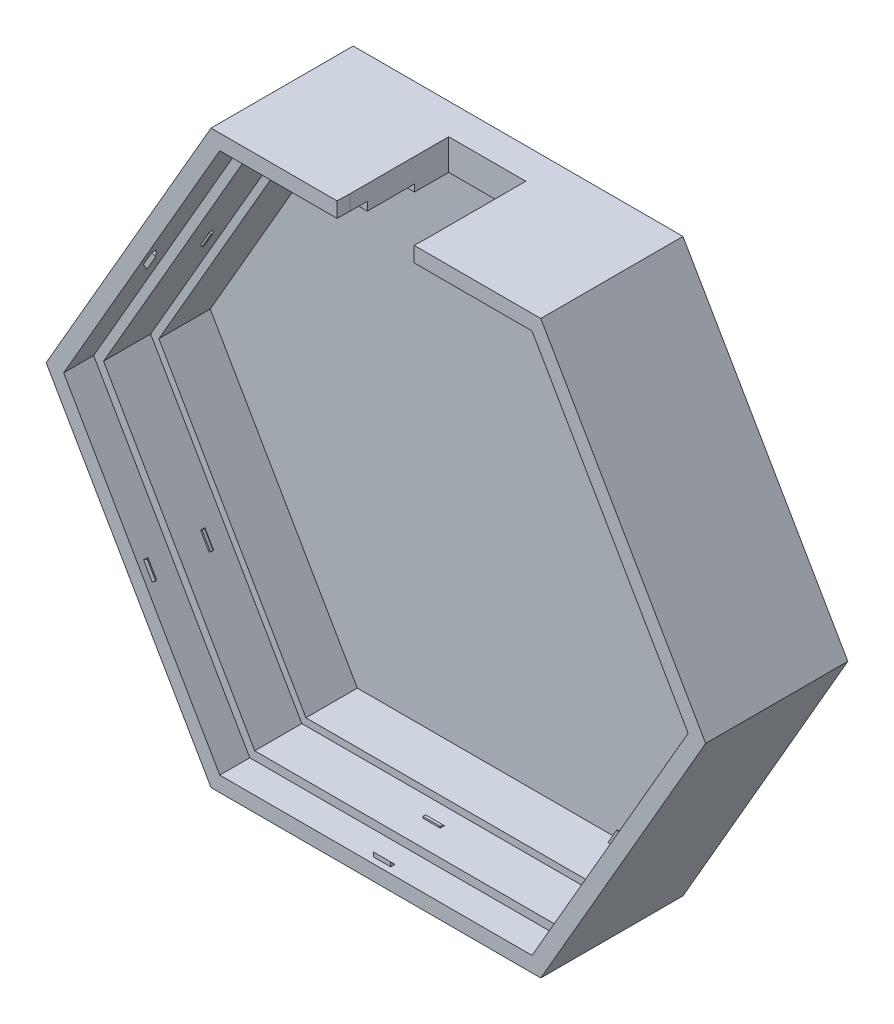
from build123d import *

# Parameters (mm, degrees)
BOSS_EXTRUDE1_DEPTH  = 10
BOSS_EXTRUDE2_DEPTH  = 1.6
BOSS_EXTRUDE5_DEPTH  = 1.6
BOSS_EXTRUDE6_DEPTH  = 2
SKETCH10_W           = 9
SKETCH10_H           = 8
CUT_EXTRUDE1_DEPTH   = 2
BOSS_EXTRUDE7_DEPTH  = 8
CUT_EXTRUDE2_DEPTH   = 4
SKETCH13_W           = 9
SKETCH13_H           = 4
CUT_EXTRUDE3_DEPTH   = 4
SKETCH16_W           = 9
SKETCH16_H           = 2
CUT_EXTRUDE4_DEPTH   = 3
BOSS_EXTRUDE10_DEPTH = 7.6
SKETCH21_W           = 9
SKETCH21_H           = 1
CUT_EXTRUDE5_DEPTH   = 6
CUT_EXTRUDE7_DEPTH   = 2.2
BOSS_EXTRUDE11_DEPTH = 2
CUT_EXTRUDE8_DEPTH   = 2
BOSS_EXTRUDE12_DEPTH = 2
BOSS_EXTRUDE13_DEPTH = 5.7
BOSS_EXTRUDE14_DEPTH = 5
CUT_EXTRUDE9_DEPTH   = 76.043267682
SKETCH30_W           = 2
SKETCH30_H           = 0.5
BOSS_EXTRUDE15_DEPTH = 0.2
CHAMFER1_SIZE        = 0.2
SKETCH31_W           = 0.5
SKETCH31_H           = 2
BOSS_EXTRUDE16_DEPTH = 0.2
CHAMFER2_SIZE        = 0.2
SKETCH32_W           = 0.5
SKETCH32_H           = 2
BOSS_EXTRUDE17_DEPTH = 0.2
CHAMFER3_SIZE        = 0.2
SKETCH33_W           = 0.5
SKETCH33_H           = 2
BOSS_EXTRUDE18_DEPTH = 0.2
CHAMFER4_SIZE        = 0.2
BOSS_EXTRUDE25_DEPTH = 2
SKETCH34_W           = 0.5
SKETCH34_H           = 2
BOSS_EXTRUDE19_DEPTH = 0.2
CHAMFER5_SIZE        = 0.2
SKETCH41_W           = 9
SKETCH41_H           = 6
CUT_EXTRUDE10_DEPTH  = 2
SKETCH42_R           = 2.75
CUT_EXTRUDE11_DEPTH  = 3.2
SKETCH50_W           = 0.5
SKETCH50_H           = 2
BOSS_EXTRUDE27_DEPTH = 0.5
SKETCH49_W           = 0.5
SKETCH49_H           = 2
BOSS_EXTRUDE28_DEPTH = 0.5
SKETCH44_W           = 2
SKETCH44_H           = 0.5
BOSS_EXTRUDE29_DEPTH = 0.5
SKETCH45_W           = 0.5
SKETCH45_H           = 2
BOSS_EXTRUDE30_DEPTH = 0.5
SKETCH47_W           = 0.5
SKETCH47_H           = 2
BOSS_EXTRUDE31_DEPTH = 0.5
CHAMFER6_SIZE        = 0.5
CHAMFER7_SIZE        = 0.5
CHAMFER8_SIZE        = 0.5
CHAMFER9_SIZE        = 0.5
CHAMFER10_SIZE       = 0.5
CUT_EXTRUDE12_DEPTH  = 30
SKETCH53_W           = 9
SKETCH53_H           = 2
BOSS_EXTRUDE32_DEPTH = 3.6


with BuildPart() as part:
    # Sketch1 → Boss-Extrude1 (new body)
    with BuildSketch(Plane.XY):
        Polygon((37.347520861, 0), (18.673760431, 32.343901834), (-18.673760431, 32.343901834), (-37.347520861, 0), (-18.673760431, -32.343901834), (18.673760431, -32.343901834), align=None)
        Polygon((35.5, 0), (17.75, 30.743901834), (-17.75, 30.743901834), (-35.5, 0), (-17.75, -30.743901834), (17.75, -30.743901834), align=None, mode=Mode.SUBTRACT)
    extrude(amount=BOSS_EXTRUDE1_DEPTH)

    # Sketch2 → Boss-Extrude2 (add)
    with BuildSketch(Plane(origin=(0, 0, 0), x_dir=(-1, 0, 0), z_dir=(0, 0, -1))):
        Polygon((36.847520861, 0), (18.423760431, 31.910889132), (-18.423760431, 31.910889132), (-36.847520861, 0), (-18.423760431, -31.910889132), (18.423760431, -31.910889132), align=None)
    extrude(amount=BOSS_EXTRUDE2_DEPTH)

    # Sketch8 → Boss-Extrude5 (add)
    with BuildSketch(Plane(origin=(0, 0, 0), x_dir=(-1, 0, 0), z_dir=(0, 0, -1))):
        Polygon((18.673760431, -32.343901834), (37.347520861, 0), (18.673760431, 32.343901834), (-18.673760431, 32.343901834), (-37.347520861, 0), (-18.673760431, -32.343901834), align=None)
    extrude(amount=BOSS_EXTRUDE5_DEPTH)

    # Sketch9 → Boss-Extrude6 (add)
    with BuildSketch(Plane.XY):
        Polygon((-17.75, 30.743901834), (-35.5, 0), (-17.75, -30.743901834), (17.75, -30.743901834), (35.5, 0), (17.75, 30.743901834), align=None)
        Polygon((-34.345299462, 0), (-17.172649731, -29.743901834), (17.172649731, -29.743901834), (34.345299462, 0), (17.172649731, 29.743901834), (-17.172649731, 29.743901834), align=None, mode=Mode.SUBTRACT)
    extrude(amount=BOSS_EXTRUDE6_DEPTH)

    # Sketch10 → Cut-Extrude1 (cut)
    with BuildSketch(Plane.XZ.offset(-30.743901834)):
        with Locations((0, 6)):
            Rectangle(SKETCH10_W, SKETCH10_H)
    extrude(amount=-CUT_EXTRUDE1_DEPTH, mode=Mode.SUBTRACT)

    # Sketch11 → Boss-Extrude7 (add)
    with BuildSketch(Plane.XY.offset(2)):
        Polygon((35.5, 0), (17.75, 30.743901834), (-17.75, 30.743901834), (-35.5, 0), (-17.75, -30.743901834), (17.75, -30.743901834), align=None)
        Polygon((35.3, 0), (17.65, 30.570696754), (-17.65, 30.570696754), (-35.3, 0), (-17.65, -30.570696754), (17.65, -30.570696754), align=None, mode=Mode.SUBTRACT)
    extrude(amount=BOSS_EXTRUDE7_DEPTH)

    # Sketch12 → Cut-Extrude2 (cut)
    with BuildSketch(Plane.XY.offset(10)):
        Polygon((37.347520861, 0), (18.673760431, 32.343901834), (-18.673760431, 32.343901834), (-37.347520861, 0), (-18.673760431, -32.343901834), (18.673760431, -32.343901834), align=None)
    extrude(amount=-CUT_EXTRUDE2_DEPTH, mode=Mode.SUBTRACT)

    # Sketch13 → Cut-Extrude3 (cut)
    with BuildSketch(Plane(origin=(0, 30.743901834, 0), x_dir=(1, 0, 0), z_dir=(0, 1, 0))):
        with Locations((0, -4)):
            Rectangle(SKETCH13_W, SKETCH13_H)
    extrude(amount=-CUT_EXTRUDE3_DEPTH, mode=Mode.SUBTRACT)

    # Sketch16 → Cut-Extrude4 (cut)
    with BuildSketch(Plane(origin=(0, 32.343901834, 0), x_dir=(1, 0, 0), z_dir=(0, 1, 0))):
        with Locations((0, -1)):
            Rectangle(SKETCH16_W, SKETCH16_H)
    extrude(amount=-CUT_EXTRUDE4_DEPTH, mode=Mode.SUBTRACT)

    # Sketch19 → Boss-Extrude10 (add)
    with BuildSketch(Plane(origin=(0, 0, -1.6), x_dir=(-1, 0, 0), z_dir=(0, 0, -1))):
        Polygon((38.5022214, 0), (19.2511107, 33.343901834), (-19.2511107, 33.343901834), (-38.5022214, 0), (-19.2511107, -33.343901834), (19.2511107, -33.343901834), align=None)
        Polygon((-18.673760431, -32.343901834), (18.673760431, -32.343901834), (37.347520861, 0), (18.673760431, 32.343901834), (-18.673760431, 32.343901834), (-37.347520861, 0), align=None, mode=Mode.SUBTRACT)
    extrude(amount=-BOSS_EXTRUDE10_DEPTH)

    # Sketch21 → Cut-Extrude5 (cut)
    with BuildSketch(Plane.XY.offset(6)):
        with Locations((0, 32.843901834)):
            Rectangle(SKETCH21_W, SKETCH21_H)
    extrude(amount=-CUT_EXTRUDE5_DEPTH, mode=Mode.SUBTRACT)

    # Sketch22 → Cut-Extrude7 (cut)
    with BuildSketch(Plane.XY.offset(6)):
        Polygon((-36.454700538, 0), (-18.227350269, -31.570696754), (18.227350269, -31.570696754), (36.454700538, 0), (18.227350269, 31.570696754), (-18.227350269, 31.570696754), align=None)
    extrude(amount=-CUT_EXTRUDE7_DEPTH, mode=Mode.SUBTRACT)

    # Sketch24 → Boss-Extrude11 (add)
    with BuildSketch(Plane(origin=(0, 0, -1.6), x_dir=(-1, 0, 0), z_dir=(0, 0, -1))):
        Polygon((-19.2511107, -33.343901834), (19.2511107, -33.343901834), (38.5022214, 0), (19.2511107, 33.343901834), (-19.2511107, 33.343901834), (-38.5022214, 0), align=None)
    extrude(amount=BOSS_EXTRUDE11_DEPTH)

    # Sketch25 → Cut-Extrude8 (cut)
    with BuildSketch(Plane.XY):
        Polygon((-17.172649731, 29.743901834), (-34.345299462, 0), (-17.172649731, -29.743901834), (17.172649731, -29.743901834), (34.345299462, 0), (17.172649731, 29.743901834), align=None)
    extrude(amount=-CUT_EXTRUDE8_DEPTH, mode=Mode.SUBTRACT)

    # Sketch26 → Boss-Extrude12 (add)
    with BuildSketch(Plane.XY.offset(6)):
        Polygon((19.2511107, 33.343901834), (-19.2511107, 33.343901834), (-38.5022214, 0), (-19.2511107, -33.343901834), (19.2511107, -33.343901834), (38.5022214, 0), align=None)
        Polygon((18.227350269, 31.570696754), (-18.227350269, 31.570696754), (-36.454700538, 0), (-18.227350269, -31.570696754), (18.227350269, -31.570696754), (36.454700538, 0), align=None, mode=Mode.SUBTRACT)
    extrude(amount=BOSS_EXTRUDE12_DEPTH)

    # Sketch27 → Boss-Extrude13 (add)
    with BuildSketch(Plane.XY.offset(3.8)):
        Polygon((-18.227350269, 31.570696754), (-36.454700538, 0), (-18.227350269, -31.570696754), (18.227350269, -31.570696754), (36.454700538, 0), (18.227350269, 31.570696754), align=None)
        Polygon((-17.65, 30.570696754), (-35.3, 0), (-17.65, -30.570696754), (17.65, -30.570696754), (35.3, 0), (17.65, 30.570696754), align=None, mode=Mode.SUBTRACT)
    extrude(amount=BOSS_EXTRUDE13_DEPTH)

    # Sketch28 → Boss-Extrude14 (add)
    with BuildSketch(Plane.XY.offset(8)):
        Polygon((19.2511107, 33.343901834), (-19.2511107, 33.343901834), (-38.5022214, 0), (-19.2511107, -33.343901834), (19.2511107, -33.343901834), (38.5022214, 0), align=None)
        Polygon((18.227350269, 31.570696754), (-18.227350269, 31.570696754), (-36.454700538, 0), (-18.227350269, -31.570696754), (18.227350269, -31.570696754), (36.454700538, 0), align=None, mode=Mode.SUBTRACT)
    extrude(amount=BOSS_EXTRUDE14_DEPTH)

    # Sketch29 → Cut-Extrude9 (cut, through all)
    with BuildSketch(Plane(origin=(0, 29.743901834, 0), x_dir=(-1, 0, 0), z_dir=(0, -1, 0))):
        Polygon((4.5, -11.503796338), (-4.5, 0), (-4.5, -1.545129158), (-4.5, -2), (-4.5, -11.739448905), align=None)
        Polygon((4.5, -1.717056643), (4.5, 0), (-4.5, 0), (4.5, -11.503796338), (4.5, -2), align=None)
        Polygon((4.5, 0), (4.5, 2), (-4.5, 0), align=None)
        Polygon((-4.5, 0), (4.5, 2), (-4.5, 2), align=None)
    extrude(amount=-CUT_EXTRUDE9_DEPTH, mode=Mode.SUBTRACT)

    # Sketch30 → Boss-Extrude15 (add)
    with BuildSketch(Plane(origin=(0, -30.570696754, 0), x_dir=(1, 0, 0), z_dir=(0, 1, 0))):
        with Locations((0, -6.25)):
            Rectangle(SKETCH30_W, SKETCH30_H)
    extrude(amount=BOSS_EXTRUDE15_DEPTH)

    # Chamfer1
    chamfer1_edges = [part.edges().sort_by_distance(p)[0] for p in [
        (0, -30.370696754, 6),
    ]]
    chamfer(chamfer1_edges, length=CHAMFER1_SIZE - 0.0001)  # a hair under: the kernel refuses the full size

    # Sketch31 → Boss-Extrude16 (add)
    with BuildSketch(Plane(origin=(-26.475, -15.285348377, 0), x_dir=(0, 0, -1), z_dir=(0.8660254037844388, 0.49999999999999994, 0))):
        with Locations((-6.25, 0)):
            Rectangle(SKETCH31_W, SKETCH31_H)
    extrude(amount=BOSS_EXTRUDE16_DEPTH)

    # Chamfer2
    chamfer2_edges = [part.edges().sort_by_distance(p)[0] for p in [
        (-26.301794919, -15.185348377, 6),
    ]]
    chamfer(chamfer2_edges, length=CHAMFER2_SIZE - 0.0001)  # a hair under: the kernel refuses the full size

    # Sketch32 → Boss-Extrude17 (add)
    with BuildSketch(Plane(origin=(-26.475, 15.285348377, 0), x_dir=(0, 0, -1), z_dir=(0.8660254037844386, -0.5000000000000002, 0))):
        with Locations((-6.25, 0)):
            Rectangle(SKETCH32_W, SKETCH32_H)
    extrude(amount=BOSS_EXTRUDE17_DEPTH)

    # Chamfer3
    chamfer3_edges = [part.edges().sort_by_distance(p)[0] for p in [
        (-26.301794919, 15.185348377, 6),
    ]]
    chamfer(chamfer3_edges, length=CHAMFER3_SIZE - 0.0001)  # a hair under: the kernel refuses the full size

    # Sketch33 → Boss-Extrude18 (add)
    with BuildSketch(Plane(origin=(26.475, -15.285348377, 0), x_dir=(0, 0, 1), z_dir=(-0.8660254037844388, 0.49999999999999967, 0))):
        with Locations((6.25, 0)):
            Rectangle(SKETCH33_W, SKETCH33_H)
    extrude(amount=BOSS_EXTRUDE18_DEPTH)

    # Chamfer4
    chamfer4_edges = [part.edges().sort_by_distance(p)[0] for p in [
        (26.301794919, -15.185348377, 6),
    ]]
    chamfer(chamfer4_edges, length=CHAMFER4_SIZE - 0.0001)  # a hair under: the kernel refuses the full size

    # Sketch40 → Boss-Extrude25 (add)
    with BuildSketch(Plane.XY.offset(2)):
        Polygon((-17.65, 30.570696754), (-35.3, 0), (-17.65, -30.570696754), (17.65, -30.570696754), (35.3, 0), (17.65, 30.570696754), align=None)
        Polygon((-17.172649731, 29.743901834), (-34.345299462, 0), (-17.172649731, -29.743901834), (17.172649731, -29.743901834), (34.345299462, 0), (17.172649731, 29.743901834), align=None, mode=Mode.SUBTRACT)
    extrude(amount=BOSS_EXTRUDE25_DEPTH)

    # Sketch34 → Boss-Extrude19 (add)
    with BuildSketch(Plane(origin=(26.475, 15.285348377, 0), x_dir=(0, 0, 1), z_dir=(-0.8660254037844387, -0.4999999999999999, 0))):
        with Locations((6.25, 0)):
            Rectangle(SKETCH34_W, SKETCH34_H)
    extrude(amount=BOSS_EXTRUDE19_DEPTH)

    # Chamfer5
    chamfer5_edges = [part.edges().sort_by_distance(p)[0] for p in [
        (26.301794919, 15.185348377, 6),
    ]]
    chamfer(chamfer5_edges, length=CHAMFER5_SIZE - 0.0001)  # a hair under: the kernel refuses the full size

    # Sketch41 → Cut-Extrude10 (cut)
    with BuildSketch(Plane(origin=(0, 29.743901834, 0), x_dir=(-1, 0, 0), z_dir=(0, -1, 0))):
        with Locations((0, -1)):
            Rectangle(SKETCH41_W, SKETCH41_H)
    extrude(amount=-CUT_EXTRUDE10_DEPTH, mode=Mode.SUBTRACT)

    # Sketch42 → Cut-Extrude11 (cut)
    with BuildSketch(Plane(origin=(0, 29.743901834, 0), x_dir=(-1, 0, 0), z_dir=(0, -1, 0))):
        with Locations(Location((-11, -1, 0), (0, 0, 180))):
            Circle(SKETCH42_R)
        with Locations(Location((11, -1, 0), (0, 0, 180))):
            Circle(SKETCH42_R)
    extrude(amount=-CUT_EXTRUDE11_DEPTH, mode=Mode.SUBTRACT)

    # Sketch50 → Boss-Extrude27 (add)
    with BuildSketch(Plane(origin=(-27.341025404, 15.785348377, 0), x_dir=(0, 0, -1), z_dir=(0.8660254037844404, -0.49999999999999695, 0))):
        with Locations((-12.05, -0.027649731)):
            Rectangle(SKETCH50_W, SKETCH50_H)
    extrude(amount=BOSS_EXTRUDE27_DEPTH)

    # Sketch49 → Boss-Extrude28 (add)
    with BuildSketch(Plane(origin=(-27.341025404, -15.785348377, 0), x_dir=(0, 0, -1), z_dir=(0.8660254037844357, 0.5000000000000052, 0))):
        with Locations((-12.05, -0.027649731)):
            Rectangle(SKETCH49_W, SKETCH49_H)
    extrude(amount=BOSS_EXTRUDE28_DEPTH)

    # Sketch44 → Boss-Extrude29 (add)
    with BuildSketch(Plane(origin=(0, -31.570696754, 0), x_dir=(1, 0, 0), z_dir=(0, 1, 0))):
        with Locations((0.027649731, -12.05)):
            Rectangle(SKETCH44_W, SKETCH44_H)
    extrude(amount=BOSS_EXTRUDE29_DEPTH)

    # Sketch45 → Boss-Extrude30 (add)
    with BuildSketch(Plane(origin=(27.341025404, -15.785348377, 0), x_dir=(0, 0, 1), z_dir=(-0.8660254037844439, 0.49999999999999106, 0))):
        with Locations((12.05, 0.027649731)):
            Rectangle(SKETCH45_W, SKETCH45_H)
    extrude(amount=BOSS_EXTRUDE30_DEPTH)

    # Sketch47 → Boss-Extrude31 (add)
    with BuildSketch(Plane(origin=(27.341025404, 15.785348377, 0), x_dir=(0, 0, 1), z_dir=(-0.8660254037844356, -0.5000000000000054, 0))):
        with Locations((12.05, 0.027649731)):
            Rectangle(SKETCH47_W, SKETCH47_H)
    extrude(amount=BOSS_EXTRUDE31_DEPTH)

    # Chamfer6
    chamfer6_edges = [part.edges().sort_by_distance(p)[0] for p in [
        (26.894187836, 15.559293746, 11.8),
    ]]
    chamfer(chamfer6_edges, length=CHAMFER6_SIZE - 0.0001)  # a hair under: the kernel refuses the full size

    # Chamfer7
    chamfer7_edges = [part.edges().sort_by_distance(p)[0] for p in [
        (26.921837567, -15.511403008, 11.8),
    ]]
    chamfer(chamfer7_edges, length=CHAMFER7_SIZE - 0.0001)  # a hair under: the kernel refuses the full size

    # Chamfer8
    chamfer8_edges = [part.edges().sort_by_distance(p)[0] for p in [
        (0.027649731, -31.070696754, 11.8),
    ]]
    chamfer(chamfer8_edges, length=CHAMFER8_SIZE - 0.0001)  # a hair under: the kernel refuses the full size

    # Chamfer9
    chamfer9_edges = [part.edges().sort_by_distance(p)[0] for p in [
        (-26.894187836, -15.559293746, 11.8),
    ]]
    chamfer(chamfer9_edges, length=CHAMFER9_SIZE - 0.0001)  # a hair under: the kernel refuses the full size

    # Chamfer10
    chamfer10_edges = [part.edges().sort_by_distance(p)[0] for p in [
        (-26.921837567, 15.511403008, 11.8),
    ]]
    chamfer(chamfer10_edges, length=CHAMFER10_SIZE - 0.0001)  # a hair under: the kernel refuses the full size

    # Sketch52 → Cut-Extrude12 (cut)
    with BuildSketch(Plane(origin=(0, 33.343901834, 0), x_dir=(1, 0, 0), z_dir=(0, 1, 0))):
        Polygon((4.5, -11.739448905), (-4.5, -11.503796338), (-4.539176026, -13), (4.466994211, -13), align=None)
    extrude(amount=-CUT_EXTRUDE12_DEPTH, mode=Mode.SUBTRACT)

    # Sketch53 → Boss-Extrude32 (add)
    with BuildSketch(Plane(origin=(0, 33.343901834, 0), x_dir=(1, 0, 0), z_dir=(0, 1, 0))):
        with Locations((0, 1)):
            Rectangle(SKETCH53_W, SKETCH53_H)
    extrude(amount=-BOSS_EXTRUDE32_DEPTH)


solid = part.part
